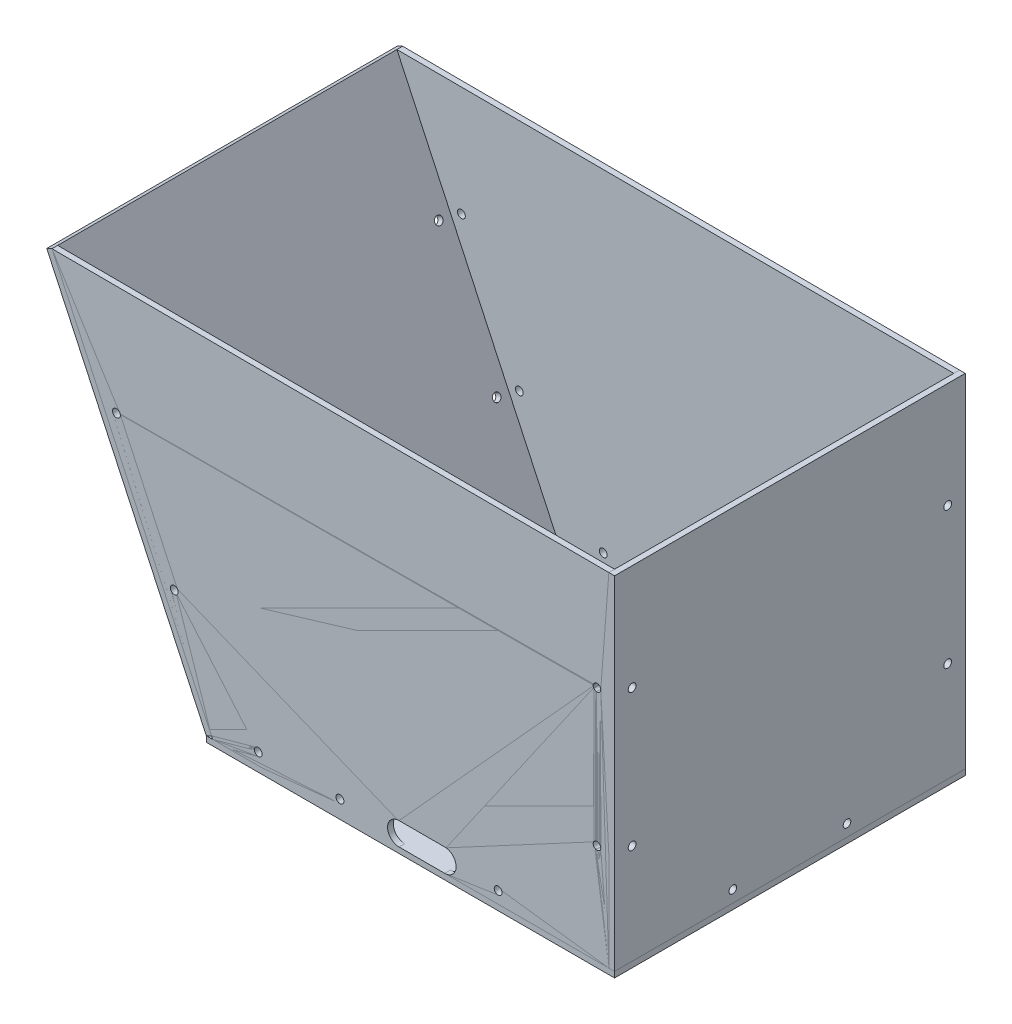
from build123d import *

# Parameters (mm, degrees)
SKETCH2_W                          = 454.025
SKETCH2_H                          = 390
BOSS_EXTRUDE1_DEPTH                = 6.35
SKETCH8_W                          = 390
SKETCH8_H                          = 381
BOSS_EXTRUDE7_DEPTH                = 6.35
SKETCH15_W                         = 390
SKETCH15_H                         = 419.861763893
BOSS_EXTRUDE12_DEPTH               = 6.35
BOSS_EXTRUDE14_DEPTH               = 6.35
MIRROR13_START                     = 188.65
MIRROR13_DEPTH                     = 6.35
MIRROR13_2_DEPTH                   = 6.35
MIRROR13_3_DEPTH                   = 6.35
CUT_EXTRUDE3_DEPTH                 = 684.694352801
F_5_16_CLEARANCE_HOLE5_AT_2_COUNT  = 2
F_5_16_CLEARANCE_HOLE5_AT_2_PITCH  = 127
F_5_16_CLEARANCE_HOLE4_AT_2_COUNT  = 2
F_5_16_CLEARANCE_HOLE4_AT_2_PITCH  = 152.4
SKETCH55_W                         = 4.36499
SKETCH55_H                         = 390
F_5_16_CLEARANCE_HOLE3_AT_2_COUNT  = 2
F_5_16_CLEARANCE_HOLE3_AT_2_PITCH  = 175.91332244
SKETCH57_W                         = 4.2164
SKETCH57_H                         = 390
F_5_16_CLEARANCE_HOLE6_AT_2_COUNT  = 2
F_5_16_CLEARANCE_HOLE6_AT_2_PITCH  = 152.4
SKETCH59_W                         = 4.2164
SKETCH59_H                         = 6.35
F_5_16_CLEARANCE_HOLE7_AT_2_COUNT  = 2
F_5_16_CLEARANCE_HOLE7_AT_2_PITCH  = 127
SKETCH61_W                         = 4.36499
SKETCH61_H                         = 390
F_5_16_CLEARANCE_HOLE8_AT_2_COUNT  = 2
F_5_16_CLEARANCE_HOLE8_AT_2_PITCH  = 152.4
F_5_16_CLEARANCE_HOLE9_AT_2_COUNT  = 2
F_5_16_CLEARANCE_HOLE9_AT_2_PITCH  = 152.4
F_5_16_CLEARANCE_HOLE10_AT_2_COUNT = 2
F_5_16_CLEARANCE_HOLE10_AT_2_PITCH = 175.91332244
F_5_16_CLEARANCE_HOLE11_AT_2_COUNT = 2
F_5_16_CLEARANCE_HOLE11_AT_2_PITCH = 175.91332244
F_5_16_CLEARANCE_HOLE11_AT_3_COUNT = 2
F_5_16_CLEARANCE_HOLE11_AT_3_PITCH = 256.592550578
F_5_16_CLEARANCE_HOLE11_AT_4_COUNT = 2
F_5_16_CLEARANCE_HOLE11_AT_4_PITCH = 186.8
F_5_16_CLEARANCE_HOLE12_AT_2_COUNT = 2
F_5_16_CLEARANCE_HOLE12_AT_2_PITCH = 350.9
SKETCH72_W                         = 4.36499
SKETCH72_H                         = 390


with BuildPart() as part:
    # Sketch2 → Boss-Extrude1 (new body)
    with BuildSketch(Plane(origin=(0, 0, 0), x_dir=(1, 0, 0), z_dir=(0, 1, 0))):
        Rectangle(SKETCH2_W, SKETCH2_H)
    extrude(amount=BOSS_EXTRUDE1_DEPTH)

    # Mirror13 3 outline → Mirror13 3 (add)
    with BuildSketch(Plane.XY.offset(MIRROR13_START)):
        Polygon((-220.006050215, 6.35), (220.6625, 6.35), (220.6625, 387.35), (-398.69869438, 389.557612057), align=None)
    extrude(amount=MIRROR13_3_DEPTH)


with BuildPart() as body_2:
    # Sketch8 → Boss-Extrude7 (new body)
    with BuildSketch(Plane(origin=(227.0125, 0, 0), x_dir=(0, 0, -1), z_dir=(1, 0, 0))):
        with Locations((0, 196.85)):
            Rectangle(SKETCH8_W, SKETCH8_H)
    extrude(amount=-BOSS_EXTRUDE7_DEPTH)

    # Mirror13 2 outline → Mirror13 2 (add)
    with BuildSketch(Plane.XY.offset(MIRROR13_START)):
        Polygon((-220.006050215, 6.35), (220.6625, 6.35), (220.6625, 387.35), (-398.69869438, 389.557612057), align=None)
    extrude(amount=MIRROR13_2_DEPTH)


with BuildPart() as body_3:
    # Sketch15 → Boss-Extrude12 (new body)
    with BuildSketch(Plane(origin=(-184.034470015, -85.816682733, 0), x_dir=(0, 0, 1), z_dir=(-0.9063077870366526, -0.42261826174069383, 0))):
        with Locations((0, 311.625564538)):
            Rectangle(SKETCH15_W, SKETCH15_H)
    extrude(amount=-BOSS_EXTRUDE12_DEPTH)

    # Mirror13: read off the stored shape, not the designer's step
    # Mirror13 outline → Mirror13 (add)
    with BuildSketch(Plane.XY.offset(MIRROR13_START)):
        Polygon((-220.006050215, 6.35), (220.6625, 6.35), (220.6625, 387.35), (-398.69869438, 389.557612057), (-221.257445552, 9.033625962), align=None)
    extrude(amount=MIRROR13_DEPTH)


with BuildPart() as body_4:
    # Sketch48 → Boss-Extrude14 (new body)
    with BuildSketch(Plane(origin=(0, 0, -195), x_dir=(-1, 0, 0), z_dir=(0, 0, -1))):
        Polygon((-220.6625, 387.35), (398.69869438, 389.557612057), (220.006050215, 6.35), (-220.6625, 6.35), align=None)
    extrude(amount=-BOSS_EXTRUDE14_DEPTH)


with BuildPart() as cut_extrude3_tool:
    # Sketch49 → Cut-Extrude3 (new, through all)
    with BuildSketch(Plane.XY.offset(195)):
        with BuildLine():
            Line((-12.7, 31.75), (38.1, 31.75))
            ThreePointArc((38.1, 31.75), (50.8, 19.05), (38.1, 6.35))
            Line((38.1, 6.35), (-12.7, 6.35))
            ThreePointArc((-12.7, 6.35), (-25.4, 19.05), (-12.7, 31.75))
        make_face()
    extrude(amount=-CUT_EXTRUDE3_DEPTH)


with BuildPart() as part_1:
    add(part.part)

    # Cut-Extrude3: cut by cut_extrude3_tool
    add(cut_extrude3_tool.part, mode=Mode.SUBTRACT)


with BuildPart() as body_2_1:
    add(body_2.part)

    # Cut-Extrude3: cut by cut_extrude3_tool
    add(cut_extrude3_tool.part, mode=Mode.SUBTRACT)

    # Sketch23 → 5/16 Clearance Hole5 (revolve, cut)
    with BuildSketch(Plane(origin=(227.0125, 19.55, 63.5), x_dir=(0, 0, -1), z_dir=(0, 1, 0))):
        Polygon((0, 0), (0, 8.883468714), (4.2164, 6.35), (4.2164, 0), align=None)
    f_5_16_clearance_hole5 = revolve(axis=Axis((233.3625, 19.55, 63.5), (-1, 0, 0)), mode=Mode.SUBTRACT)

    # 5/16 Clearance Hole5 at 2: 5/16 Clearance Hole5 ×2
    with Locations(*[(0, 0, -i * F_5_16_CLEARANCE_HOLE5_AT_2_PITCH) for i in range(1, F_5_16_CLEARANCE_HOLE5_AT_2_COUNT)]):
        add(f_5_16_clearance_hole5, mode=Mode.SUBTRACT)

    # Sketch33 → 5/16 Clearance Hole4 (revolve, cut)
    with BuildSketch(Plane(origin=(227.0125, 269.875, -175.45), x_dir=(0, 0, -1), z_dir=(0, 1, 0))):
        Polygon((0, 0), (0, 8.972750593), (4.36499, 6.35), (4.36499, 0), align=None)
    f_5_16_clearance_hole4 = revolve(axis=Axis((233.3625, 269.875, -175.45), (-1, 0, 0)), mode=Mode.SUBTRACT)

    # 5/16 Clearance Hole4 at 2: 5/16 Clearance Hole4 ×2
    with Locations(*[(0, -i * F_5_16_CLEARANCE_HOLE4_AT_2_PITCH, 0) for i in range(1, F_5_16_CLEARANCE_HOLE4_AT_2_COUNT)]):
        add(f_5_16_clearance_hole4, mode=Mode.SUBTRACT)

    # Mirror2: 5/16 Clearance Hole4 across plane
    add(f_5_16_clearance_hole4.mirror(Plane.XY), mode=Mode.SUBTRACT)

    # Mirror2 copy 1 sketch → Mirror2 copy 1 (revolve, cut)
    with BuildSketch(Plane(origin=(227.0125, 117.475, 175.45), x_dir=(0, 0, 1), z_dir=(0, 1, 0))):
        Polygon((0, 0), (0, -8.972750593), (4.36499, -6.35), (4.36499, 0), align=None)
    revolve(axis=Axis((233.3625, 117.475, 175.45), (1, 0, 0)), mode=Mode.SUBTRACT)


with BuildPart() as body_3_1:
    add(body_3.part)

    # Cut-Extrude3: cut by cut_extrude3_tool
    add(cut_extrude3_tool.part, mode=Mode.SUBTRACT)


with BuildPart() as body_4_1:
    add(body_4.part)

    # Cut-Extrude3: cut by cut_extrude3_tool
    add(cut_extrude3_tool.part, mode=Mode.SUBTRACT)


with BuildPart() as f_5_16_clearance_hole3_tool:
    # Sketch55 → 5/16 Clearance Hole3 (revolve)
    with BuildSketch(Plane(origin=(97.5525, 19.55, -195), x_dir=(0, 1, 0), z_dir=(1, 0, 0))):
        with Locations((2.182495, 195)):
            Rectangle(SKETCH55_W, SKETCH55_H)
    f_5_16_clearance_hole3 = revolve(axis=Axis((97.5525, 19.55, -201.35), (0, 0, 1)))


with BuildPart() as part_2:
    add(part_1.part)

    # 5/16 Clearance Hole3: cut by f_5_16_clearance_hole3_tool
    add(f_5_16_clearance_hole3_tool.part, mode=Mode.SUBTRACT)


with BuildPart() as body_2_2:
    add(body_2_1.part)

    # 5/16 Clearance Hole3: cut by f_5_16_clearance_hole3_tool
    add(f_5_16_clearance_hole3_tool.part, mode=Mode.SUBTRACT)


with BuildPart() as body_3_2:
    add(body_3_1.part)

    # 5/16 Clearance Hole3: cut by f_5_16_clearance_hole3_tool
    add(f_5_16_clearance_hole3_tool.part, mode=Mode.SUBTRACT)


with BuildPart() as body_4_2:
    add(body_4_1.part)

    # 5/16 Clearance Hole3: cut by f_5_16_clearance_hole3_tool
    add(f_5_16_clearance_hole3_tool.part, mode=Mode.SUBTRACT)


with BuildPart() as f_5_16_clearance_hole3_at_2_tool:
    # 5/16 Clearance Hole3 at 2: 5/16 Clearance Hole3 ×2
    with Locations(*[(-i * F_5_16_CLEARANCE_HOLE3_AT_2_PITCH, 0, 0) for i in range(1, F_5_16_CLEARANCE_HOLE3_AT_2_COUNT)]):
        add(f_5_16_clearance_hole3)


with BuildPart() as part_3:
    add(part_2.part)

    # 5/16 Clearance Hole3 at 2: cut by f_5_16_clearance_hole3_at_2_tool
    add(f_5_16_clearance_hole3_at_2_tool.part, mode=Mode.SUBTRACT)


with BuildPart() as body_2_3:
    add(body_2_2.part)

    # 5/16 Clearance Hole3 at 2: cut by f_5_16_clearance_hole3_at_2_tool
    add(f_5_16_clearance_hole3_at_2_tool.part, mode=Mode.SUBTRACT)


with BuildPart() as body_3_3:
    add(body_3_2.part)

    # 5/16 Clearance Hole3 at 2: cut by f_5_16_clearance_hole3_at_2_tool
    add(f_5_16_clearance_hole3_at_2_tool.part, mode=Mode.SUBTRACT)


with BuildPart() as body_4_3:
    add(body_4_2.part)

    # 5/16 Clearance Hole3 at 2: cut by f_5_16_clearance_hole3_at_2_tool
    add(f_5_16_clearance_hole3_at_2_tool.part, mode=Mode.SUBTRACT)


with BuildPart() as f_5_16_clearance_hole6_tool:
    # Sketch57 → 5/16 Clearance Hole6 (revolve)
    with BuildSketch(Plane(origin=(207.4625, 269.898524625, -195), x_dir=(0, 1, 0), z_dir=(1, 0, 0))):
        with Locations((2.1082, 195)):
            Rectangle(SKETCH57_W, SKETCH57_H)
    f_5_16_clearance_hole6 = revolve(axis=Axis((207.4625, 269.898524625, -201.35), (0, 0, 1)))


with BuildPart() as part_4:
    add(part_3.part)

    # 5/16 Clearance Hole6: cut by f_5_16_clearance_hole6_tool
    add(f_5_16_clearance_hole6_tool.part, mode=Mode.SUBTRACT)


with BuildPart() as body_2_4:
    add(body_2_3.part)

    # 5/16 Clearance Hole6: cut by f_5_16_clearance_hole6_tool
    add(f_5_16_clearance_hole6_tool.part, mode=Mode.SUBTRACT)


with BuildPart() as body_3_4:
    add(body_3_3.part)

    # 5/16 Clearance Hole6: cut by f_5_16_clearance_hole6_tool
    add(f_5_16_clearance_hole6_tool.part, mode=Mode.SUBTRACT)


with BuildPart() as body_4_4:
    add(body_4_3.part)

    # 5/16 Clearance Hole6: cut by f_5_16_clearance_hole6_tool
    add(f_5_16_clearance_hole6_tool.part, mode=Mode.SUBTRACT)


with BuildPart() as f_5_16_clearance_hole6_at_2_tool:
    # 5/16 Clearance Hole6 at 2: 5/16 Clearance Hole6 ×2
    with Locations(*[(0, -i * F_5_16_CLEARANCE_HOLE6_AT_2_PITCH, 0) for i in range(1, F_5_16_CLEARANCE_HOLE6_AT_2_COUNT)]):
        add(f_5_16_clearance_hole6)


with BuildPart() as part_5:
    add(part_4.part)

    # 5/16 Clearance Hole6 at 2: cut by f_5_16_clearance_hole6_at_2_tool
    add(f_5_16_clearance_hole6_at_2_tool.part, mode=Mode.SUBTRACT)

    # Sketch59 → 5/16 Clearance Hole7 (revolve, cut)
    with BuildSketch(Plane(origin=(207.4625, 6.35, -63.5), x_dir=(0, 0, 1), z_dir=(1, 0, 0))):
        with Locations((2.1082, 3.175)):
            Rectangle(SKETCH59_W, SKETCH59_H)
    f_5_16_clearance_hole7 = revolve(axis=Axis((207.4625, 12.7, -63.5), (0, -1, 0)), mode=Mode.SUBTRACT)

    # 5/16 Clearance Hole7 at 2: 5/16 Clearance Hole7 ×2
    with Locations(*[(0, 0, i * F_5_16_CLEARANCE_HOLE7_AT_2_PITCH) for i in range(1, F_5_16_CLEARANCE_HOLE7_AT_2_COUNT)]):
        add(f_5_16_clearance_hole7, mode=Mode.SUBTRACT)


with BuildPart() as body_2_5:
    add(body_2_4.part)

    # 5/16 Clearance Hole6 at 2: cut by f_5_16_clearance_hole6_at_2_tool
    add(f_5_16_clearance_hole6_at_2_tool.part, mode=Mode.SUBTRACT)


with BuildPart() as body_3_5:
    add(body_3_4.part)

    # 5/16 Clearance Hole6 at 2: cut by f_5_16_clearance_hole6_at_2_tool
    add(f_5_16_clearance_hole6_at_2_tool.part, mode=Mode.SUBTRACT)


with BuildPart() as body_4_5:
    add(body_4_4.part)

    # 5/16 Clearance Hole6 at 2: cut by f_5_16_clearance_hole6_at_2_tool
    add(f_5_16_clearance_hole6_at_2_tool.part, mode=Mode.SUBTRACT)


with BuildPart() as f_5_16_clearance_hole8_tool:
    # Sketch61 → 5/16 Clearance Hole8 (revolve)
    with BuildSketch(Plane(origin=(-326.979171422, 266.988459636, -195), x_dir=(0, 1, 0), z_dir=(1, 0, 0))):
        with Locations((2.182495, 195)):
            Rectangle(SKETCH61_W, SKETCH61_H)
    f_5_16_clearance_hole8 = revolve(axis=Axis((-326.979171422, 266.988459636, -201.35), (0, 0, 1)))


with BuildPart() as part_6:
    add(part_5.part)

    # 5/16 Clearance Hole8: cut by f_5_16_clearance_hole8_tool
    add(f_5_16_clearance_hole8_tool.part, mode=Mode.SUBTRACT)


with BuildPart() as body_2_6:
    add(body_2_5.part)

    # 5/16 Clearance Hole8: cut by f_5_16_clearance_hole8_tool
    add(f_5_16_clearance_hole8_tool.part, mode=Mode.SUBTRACT)


with BuildPart() as body_3_6:
    add(body_3_5.part)

    # 5/16 Clearance Hole8: cut by f_5_16_clearance_hole8_tool
    add(f_5_16_clearance_hole8_tool.part, mode=Mode.SUBTRACT)


with BuildPart() as body_4_6:
    add(body_4_5.part)

    # 5/16 Clearance Hole8: cut by f_5_16_clearance_hole8_tool
    add(f_5_16_clearance_hole8_tool.part, mode=Mode.SUBTRACT)


with BuildPart() as f_5_16_clearance_hole8_at_2_tool:
    # 5/16 Clearance Hole8 at 2: 5/16 Clearance Hole8 ×2
    with Locations(*[Vector(0.42261826174069383, -0.9063077870366526, 0) * (i * F_5_16_CLEARANCE_HOLE8_AT_2_PITCH) for i in range(1, F_5_16_CLEARANCE_HOLE8_AT_2_COUNT)]):
        add(f_5_16_clearance_hole8)


with BuildPart() as part_7:
    add(part_6.part)

    # 5/16 Clearance Hole8 at 2: cut by f_5_16_clearance_hole8_at_2_tool
    add(f_5_16_clearance_hole8_at_2_tool.part, mode=Mode.SUBTRACT)

    # Sketch65 → 5/16 Clearance Hole10 (revolve, cut)
    with BuildSketch(Plane(origin=(97.5525, 6.35, -175.45), x_dir=(0, 0, 1), z_dir=(1, 0, 0))):
        Polygon((0, 0), (0, 8.972750593), (4.36499, 6.35), (4.36499, 0), align=None)
    f_5_16_clearance_hole10 = revolve(axis=Axis((97.5525, 12.7, -175.45), (0, -1, 0)), mode=Mode.SUBTRACT)

    # 5/16 Clearance Hole10 at 2: 5/16 Clearance Hole10 ×2
    with Locations(*[(-i * F_5_16_CLEARANCE_HOLE10_AT_2_PITCH, 0, 0) for i in range(1, F_5_16_CLEARANCE_HOLE10_AT_2_COUNT)]):
        add(f_5_16_clearance_hole10, mode=Mode.SUBTRACT)

    # Mirror16: 5/16 Clearance Hole10 across plane
    add(f_5_16_clearance_hole10.mirror(Plane.XY), mode=Mode.SUBTRACT)

    # Mirror16 copy 1 sketch → Mirror16 copy 1 (revolve, cut)
    with BuildSketch(Plane(origin=(-78.36082244, 6.35, 175.45), x_dir=(0, 0, -1), z_dir=(1, 0, 0))):
        Polygon((0, 0), (0, -8.972750593), (4.36499, -6.35), (4.36499, 0), align=None)
    revolve(axis=Axis((-78.36082244, 12.7, 175.45), (0, 1, 0)), mode=Mode.SUBTRACT)

    # Sketch67 → 5/16 Clearance Hole11 (revolve, cut)
    with BuildSketch(Plane(origin=(-78.36082244, 6.35, -93.4), x_dir=(0, 0, 1), z_dir=(1, 0, 0))):
        Polygon((0, 0), (0, 8.972750593), (4.36499, 6.35), (4.36499, 0), align=None)
    f_5_16_clearance_hole11 = revolve(axis=Axis((-78.36082244, 12.7, -93.4), (0, -1, 0)), mode=Mode.SUBTRACT)

    # 5/16 Clearance Hole11 at 2: 5/16 Clearance Hole11 ×2
    with Locations(*[(i * F_5_16_CLEARANCE_HOLE11_AT_2_PITCH, 0, 0) for i in range(1, F_5_16_CLEARANCE_HOLE11_AT_2_COUNT)]):
        add(f_5_16_clearance_hole11, mode=Mode.SUBTRACT)

    # 5/16 Clearance Hole11 at 3: 5/16 Clearance Hole11 ×2
    with Locations(*[Vector(0.6855745501732765, 0, 0.7280024286736341) * (i * F_5_16_CLEARANCE_HOLE11_AT_3_PITCH) for i in range(1, F_5_16_CLEARANCE_HOLE11_AT_3_COUNT)]):
        add(f_5_16_clearance_hole11, mode=Mode.SUBTRACT)

    # 5/16 Clearance Hole11 at 4: 5/16 Clearance Hole11 ×2
    with Locations(*[(0, 0, i * F_5_16_CLEARANCE_HOLE11_AT_4_PITCH) for i in range(1, F_5_16_CLEARANCE_HOLE11_AT_4_COUNT)]):
        add(f_5_16_clearance_hole11, mode=Mode.SUBTRACT)

    # Sketch69 → 5/16 Clearance Hole12 (revolve, cut)
    with BuildSketch(Plane(origin=(-170.457445552, 6.35, -175.45), x_dir=(0, 0, 1), z_dir=(1, 0, 0))):
        Polygon((0, 0), (0, 8.972750593), (4.36499, 6.35), (4.36499, 0), align=None)
    f_5_16_clearance_hole12 = revolve(axis=Axis((-170.457445552, 12.7, -175.45), (0, -1, 0)), mode=Mode.SUBTRACT)

    # 5/16 Clearance Hole12 at 2: 5/16 Clearance Hole12 ×2
    with Locations(*[(0, 0, i * F_5_16_CLEARANCE_HOLE12_AT_2_PITCH) for i in range(1, F_5_16_CLEARANCE_HOLE12_AT_2_COUNT)]):
        add(f_5_16_clearance_hole12, mode=Mode.SUBTRACT)


with BuildPart() as body_2_7:
    add(body_2_6.part)

    # 5/16 Clearance Hole8 at 2: cut by f_5_16_clearance_hole8_at_2_tool
    add(f_5_16_clearance_hole8_at_2_tool.part, mode=Mode.SUBTRACT)


with BuildPart() as body_3_7:
    add(body_3_6.part)

    # 5/16 Clearance Hole8 at 2: cut by f_5_16_clearance_hole8_at_2_tool
    add(f_5_16_clearance_hole8_at_2_tool.part, mode=Mode.SUBTRACT)

    # Sketch64 → 5/16 Clearance Hole9 (revolve, cut)
    with BuildSketch(Plane(origin=(-344.69748515, 258.726265095, -175.45), x_dir=(0.42261826174069383, -0.9063077870366527, 0), z_dir=(0, 0, 1))):
        Polygon((0, 0), (0, 8.972750593), (4.36499, 6.35), (4.36499, 0), align=None)
    f_5_16_clearance_hole9 = revolve(axis=Axis((-350.452539598, 256.042639133, -175.45), (0.9063077870366527, 0.42261826174069356, 0)), mode=Mode.SUBTRACT)

    # 5/16 Clearance Hole9 at 2: 5/16 Clearance Hole9 ×2
    with Locations(*[Vector(0.4226182617406935, -0.9063077870366527, 0) * (i * F_5_16_CLEARANCE_HOLE9_AT_2_PITCH) for i in range(1, F_5_16_CLEARANCE_HOLE9_AT_2_COUNT)]):
        add(f_5_16_clearance_hole9, mode=Mode.SUBTRACT)

    # Mirror15: 5/16 Clearance Hole9 across plane
    add(f_5_16_clearance_hole9.mirror(Plane.XY), mode=Mode.SUBTRACT)

    # Mirror15 copy 1 sketch → Mirror15 copy 1 (revolve, cut)
    with BuildSketch(Plane(origin=(-280.290462061, 120.604958351, 175.45), x_dir=(0.42261826174069383, -0.9063077870366527, 0), z_dir=(0, 0, -1))):
        Polygon((0, 0), (0, -8.972750593), (4.36499, -6.35), (4.36499, 0), align=None)
    revolve(axis=Axis((-286.045516509, 117.921332389, 175.45), (-0.9063077870366527, -0.42261826174069356, 0)), mode=Mode.SUBTRACT)


with BuildPart() as body_4_7:
    add(body_4_6.part)

    # 5/16 Clearance Hole8 at 2: cut by f_5_16_clearance_hole8_at_2_tool
    add(f_5_16_clearance_hole8_at_2_tool.part, mode=Mode.SUBTRACT)


with BuildPart() as f_5_16_clearance_hole13_tool:
    # Sketch72 → 5/16 Clearance Hole13 (revolve)
    with BuildSketch(Plane(origin=(-169.206050215, 19.55, 195), x_dir=(0, -1, 0), z_dir=(1, 0, 0))):
        with Locations((2.182495, 195)):
            Rectangle(SKETCH72_W, SKETCH72_H)
    revolve(axis=Axis((-169.206050215, 19.55, 201.35), (0, 0, -1)))


with BuildPart() as part_8:
    add(part_7.part)

    # 5/16 Clearance Hole13: cut by f_5_16_clearance_hole13_tool
    add(f_5_16_clearance_hole13_tool.part, mode=Mode.SUBTRACT)


with BuildPart() as body_2_8:
    add(body_2_7.part)

    # 5/16 Clearance Hole13: cut by f_5_16_clearance_hole13_tool
    add(f_5_16_clearance_hole13_tool.part, mode=Mode.SUBTRACT)


with BuildPart() as body_3_8:
    add(body_3_7.part)

    # 5/16 Clearance Hole13: cut by f_5_16_clearance_hole13_tool
    add(f_5_16_clearance_hole13_tool.part, mode=Mode.SUBTRACT)


with BuildPart() as body_4_8:
    add(body_4_7.part)

    # 5/16 Clearance Hole13: cut by f_5_16_clearance_hole13_tool
    add(f_5_16_clearance_hole13_tool.part, mode=Mode.SUBTRACT)


solid = Compound([part_8.part, body_2_8.part, body_3_8.part, body_4_8.part])
